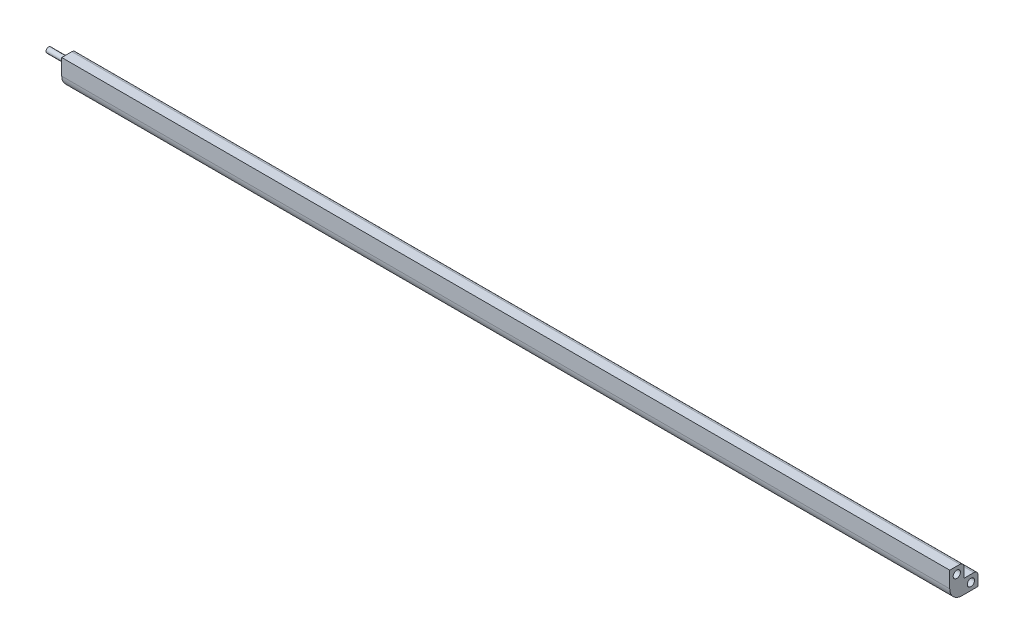
from build123d import *

# Parameters (mm, degrees)
BOSS_EXTRUDE1_DEPTH = 220
SKETCH2_R           = 0.9
CUT_EXTRUDE1_DEPTH  = 6
SKETCH1_3_R         = 0.65
BOSS_EXTRUDE2_DEPTH = 5
FILLET1_R           = 3
FILLET2_R           = 1


with BuildPart() as part:
    # Sketch1 → Boss-Extrude1 (new body)
    with BuildSketch(Plane(origin=(-29.212578399, 0, 0), x_dir=(0, 0, -1), z_dir=(1, 0, 0))):
        Polygon((7.945170891, 30.970791156), (7.945170891, 34.470791156), (4.445170891, 34.470791156), (4.445170891, 27.470791156), (11.445170891, 27.470791156), (11.445170891, 30.970791156), align=None)
    extrude(amount=BOSS_EXTRUDE1_DEPTH)

    # Sketch2 → Cut-Extrude1 (cut)
    with BuildSketch(Plane(origin=(190.787421601, 0, 0), x_dir=(0, 0, -1), z_dir=(1, 0, 0))):
        with Locations((6.195170891, 32.720791156)):
            Circle(SKETCH2_R)
        with Locations((9.695170891, 29.220791156)):
            Circle(SKETCH2_R)
    extrude(amount=-CUT_EXTRUDE1_DEPTH, mode=Mode.SUBTRACT)

    # Sketch1<3> → Boss-Extrude2 (add)
    with BuildSketch(Plane(origin=(-29.212578399, 0, 0), x_dir=(0, 0, -1), z_dir=(1, 0, 0))):
        with Locations((6.195170891, 32.720791156)):
            Circle(SKETCH1_3_R)
        with Locations((9.695170891, 29.220791156)):
            Circle(SKETCH1_3_R)
    extrude(amount=-BOSS_EXTRUDE2_DEPTH)

    # Fillet1
    fillet1_edges = [part.edges().sort_by_distance(p)[0] for p in [
        (80.787421601, 27.470791156, -4.445170891),
    ]]
    fillet(fillet1_edges, radius=FILLET1_R)

    # Fillet2
    fillet2_edges = [part.edges().sort_by_distance(p)[0] for p in [
        (80.787421601, 30.970791156, -11.445170891),
        (80.787421601, 34.470791156, -7.945170891),
    ]]
    fillet(fillet2_edges, radius=FILLET2_R)


solid = part.part
